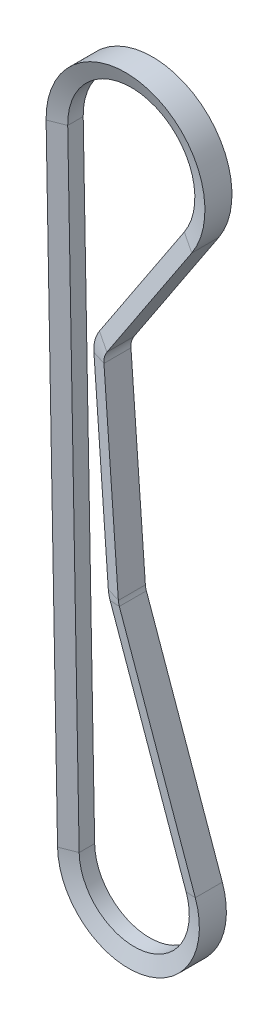
from build123d import *


with BuildPart() as part:
    # Sweep1: sweep along a path in Sketch2
    with BuildLine(Plane.XY) as sweep1_path:
        Line((-24.995788911, -0.458842782), (-29.03322996, 219.483647587))
        ThreePointArc((-29.03322996, 219.483647587), (6.782596745, 246.883218786), (22.313790523, 204.547749445))
        Line((22.313790523, 204.547749445), (-7.600420659, 159.333656307))
        ThreePointArc((-7.600420659, 159.333656307), (-8.447696672, 157.437537737), (-8.637867228, 155.369452286))
        Line((-8.637867228, 155.369452286), (-3.562485527, 85.553691167))
        ThreePointArc((-3.562485527, 85.553691167), (-3.444138113, 84.711400839), (-3.214283363, 83.892483322))
        Line((-3.214283363, 83.892483322), (23.563325736, 8.352824689))
        ThreePointArc((23.563325736, 8.352824689), (4.463670977, -24.598285335), (-24.995788911, -0.458842782))
    # Sketch3 → Sweep1 (sweep)
    with BuildSketch(Plane(origin=(23.563325736, 8.352824689, 0), x_dir=(-0.9425330294238156, -0.3341129875433829, 0), z_dir=(0.3341129875433829, -0.9425330294238156, 0))):
        Polygon((0, -4.7625), (0, 4.7625), (5.588, 2.728634331), (5.588, -2.728634331), align=None)
    sweep(path=sweep1_path.line)


solid = part.part
